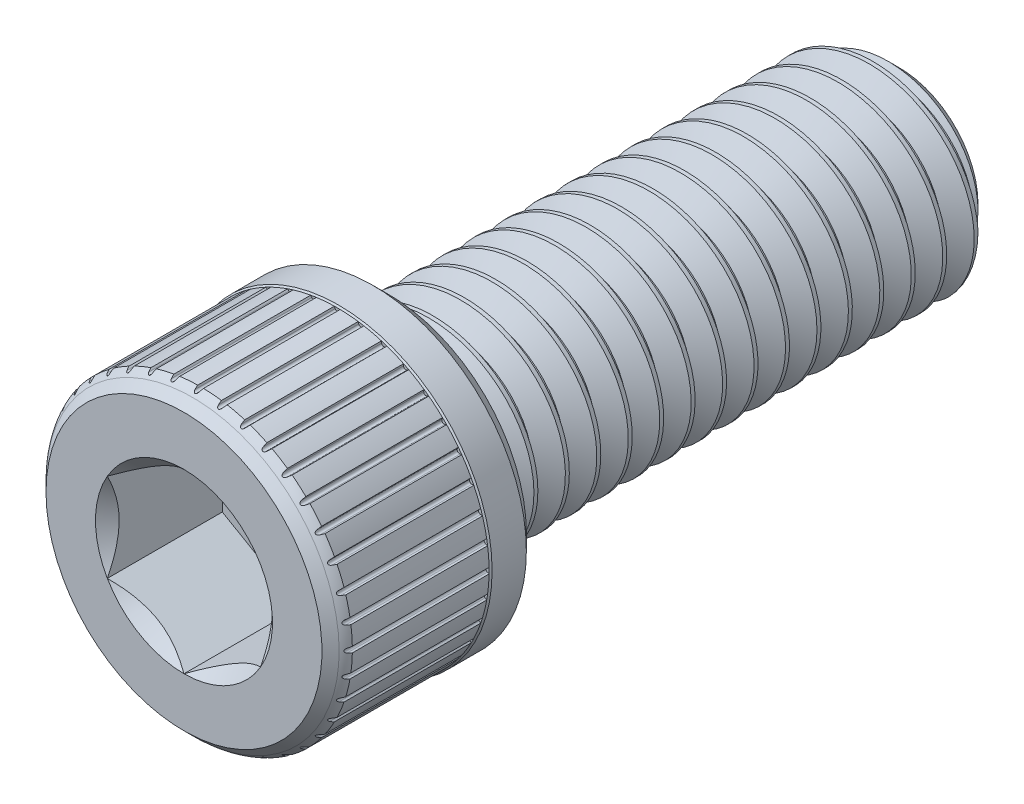
from build123d import *

# Parameters (mm, degrees)
CHAMFER1_SIZE      = 0.9525
FILLET1_R          = 1.42875
CHAMFER2_SIZE      = 1.465384615
CUT_EXTRUDE1_DEPTH = 7.14375
CUT_SWEEP1_PITCH   = 1.953846154
CUT_SWEEP1_TO      = 31.75
SKETCH10_OUTSIDE_W = 31.446
SKETCH10_OUTSIDE_H = 31.446
SKETCH10_OUTSIDE_R = 9.42975
CUT_EXTRUDE5_DEPTH = 38.432698083
CHAMFER3_SIZE      = 0.09525
CUT_EXTRUDE4_DEPTH = 38.432698032
CIRPATTERN1_COUNT  = 40


with BuildPart() as part:
    # Sketch3 → Revolve1 (revolve)
    with BuildSketch(Plane(origin=(0, 0, 0), x_dir=(0, 0, -1), z_dir=(1, 0, 0)), mode=Mode.PRIVATE) as revolve1_sk:
        Polygon((-22.225, 0), (22.225, 0), (22.225, 6.35), (-9.525, 6.35), (-9.525, 9.525), (-22.225, 9.525), align=None)
    revolve(revolve1_sk.sketch.rotate(Axis((0, 0, 22.225), (0, 0, -1)), 90), axis=Axis((0, 0, 22.225), (0, 0, -1)))

    # Chamfer1
    chamfer1_edges = [part.edges().sort_by_distance(p)[0] for p in [
        (-9.525, 0, 9.525),
        (-9.525, 0, 22.225),
    ]]
    chamfer(chamfer1_edges, length=CHAMFER1_SIZE)

    # Fillet1
    fillet1_edges = [part.edges().sort_by_distance(p)[0] for p in [
        (-9.525, 0, 21.2725),
    ]]
    fillet(fillet1_edges, radius=FILLET1_R)

    # Chamfer2
    chamfer2_edges = [part.edges().sort_by_distance(p)[0] for p in [
        (-6.35, 0, -22.225),
    ]]
    chamfer(chamfer2_edges, length=CHAMFER2_SIZE)

    # Sketch4 → Cut-Extrude1 (cut)
    with BuildSketch(Plane.XY.offset(22.225)):
        Polygon((-4.7625, -2.749630657), (0, -5.499261314), (4.7625, -2.749630657), (4.7625, 2.749630657), (0, 5.499261314), (-4.7625, 2.749630657), align=None)
    extrude(amount=-CUT_EXTRUDE1_DEPTH, mode=Mode.SUBTRACT)

    # Cut-Extrude2 cone 1 section (through the dimple's axis) → Cut-Extrude2 (revolve, cut)
    with BuildSketch(Plane(origin=(0, 0, 22.225), x_dir=(0, -1, 0), z_dir=(1, 0, 0))):
        Polygon((0, 0), (5.499261314, 0), (0, 5.499261314), align=None)
    revolve(axis=Axis((0, 0, 22.225), (0, 0, -1)), mode=Mode.SUBTRACT)


with BuildPart() as body_2:
    # Split1: read off the stored shape, not the designer's step
    # Split1: the piece on the far side of the plane
    add(part.part)
    split(bisect_by=Plane.XY.offset(9.525), keep=Keep.BOTTOM)

    # Cut-Sweep1: arcs per turn and ends read off the stored shape
    # Cut-Sweep1: the profile of Sketch7 profile screwed along a right-hand helix through 17.25 turns, 10 arcs to a turn; built about Z, then put on its axis
    cut_sweep1_z = Axis((0, 0, 0), (0, 0, 1))
    cut_sweep1_corners = [(6.3503, 0, 0.000173205), (6.3503, 0, -1.70978859), (5.080939697, 0, -0.976923077), (5.080939697, 0, -0.732692308)]
    with BuildLine(mode=Mode.PRIVATE) as cut_sweep1_profile:
        Line(cut_sweep1_corners[0], cut_sweep1_corners[1])
        Line(cut_sweep1_corners[1], cut_sweep1_corners[2])
        Line(cut_sweep1_corners[2], cut_sweep1_corners[3])
        Line(cut_sweep1_corners[3], cut_sweep1_corners[0])
    cut_sweep1_cap = Face(cut_sweep1_profile.wire())
    cut_sweep1_turn_angles = [0, 18, 36, 54, 72, 90, 108, 126, 144, 162, 180, 198, 216, 234, 252, 270, 288, 306, 324, 342, 360]
    cut_sweep1_turn_weights = [1, 0.9510565162951535, 1, 0.9510565162951535, 1, 0.9510565162951535, 1, 0.9510565162951535, 1, 0.9510565162951535, 1, 0.9510565162951535, 1, 0.9510565162951535, 1, 0.9510565162951535, 1, 0.9510565162951535, 1, 0.9510565162951535, 1]
    cut_sweep1_turn_rails = [Edge.make_bspline([Vector(p[0], p[1], 0).rotate(cut_sweep1_z, cut_sweep1_turn_angles[k]) / cut_sweep1_turn_weights[k] + Vector(0, 0, p[2] + CUT_SWEEP1_PITCH * cut_sweep1_turn_angles[k] / 360) for k in range(21)], [0, 0, 0, 1, 1, 2, 2, 3, 3, 4, 4, 5, 5, 6, 6, 7, 7, 8, 8, 9, 9, 10, 10, 10], 2, cut_sweep1_turn_weights) for p in cut_sweep1_corners]
    cut_sweep1_turn_sides = [Face.make_surface_from_curves(cut_sweep1_turn_rails[p[0]], cut_sweep1_turn_rails[p[1]]) for p in [(0, 1), (1, 2), (2, 3), (3, 0)]]
    cut_sweep1_last_angles = [6120, 6138, 6156, 6174, 6192, 6201, 6210]
    cut_sweep1_last_weights = [1, 0.9510565162951535, 1, 0.9510565162951535, 1, 0.9876883405951812, 1]
    cut_sweep1_last_rails = [Edge.make_bspline([Vector(p[0], p[1], 0).rotate(cut_sweep1_z, cut_sweep1_last_angles[k]) / cut_sweep1_last_weights[k] + Vector(0, 0, p[2] + CUT_SWEEP1_PITCH * cut_sweep1_last_angles[k] / 360) for k in range(7)], [0, 0, 0, 1, 1, 2, 2, 3, 3, 3], 2, cut_sweep1_last_weights) for p in cut_sweep1_corners]
    cut_sweep1_last_sides = [Face.make_surface_from_curves(cut_sweep1_last_rails[p[0]], cut_sweep1_last_rails[p[1]]) for p in [(0, 1), (1, 2), (2, 3), (3, 0)]]
    cut_sweep1 = Plane(origin=(0, 0, -22.225), x_dir=(0, 1, 0), z_dir=(0, 0, 1)) * split(Solid(Shell([*[p.moved(Location((0, 0, CUT_SWEEP1_PITCH * i))) for i in range(17) for p in cut_sweep1_turn_sides], *cut_sweep1_last_sides, cut_sweep1_cap, cut_sweep1_cap.rotate(cut_sweep1_z, 6210).moved(Location((0, 0, CUT_SWEEP1_PITCH * 6210 / 360)))])), bisect_by=Plane.XY.offset(CUT_SWEEP1_TO), keep=Keep.BOTTOM, mode=Mode.PRIVATE)
    add(cut_sweep1, mode=Mode.SUBTRACT)


with BuildPart() as part_1:
    add(part.part)

    # Split1
    split(bisect_by=Plane.XY.offset(9.525), keep=Keep.TOP)


with BuildPart() as body_2_1:
    add(body_2.part)

    # Combine1: union part
    add(part_1.part)

    # Sketch10 outside → Cut-Extrude5 (cut, through all)
    with BuildSketch(Plane.XY.offset(12.7)):
        Rectangle(SKETCH10_OUTSIDE_W, SKETCH10_OUTSIDE_H)
        with Locations(Location((0, 0, 0), (0, 0, 180))):
            Circle(SKETCH10_OUTSIDE_R, mode=Mode.SUBTRACT)
    extrude(amount=CUT_EXTRUDE5_DEPTH, mode=Mode.SUBTRACT)

    # Chamfer3
    chamfer3_edges = [body_2_1.edges().sort_by_distance(p)[0] for p in [
        (-9.525, 0, 12.7),
    ]]
    chamfer(chamfer3_edges, length=CHAMFER3_SIZE - 0.0001)  # a hair under: the kernel refuses the full size

    # Sketch8 → Cut-Extrude4 (cut, through all)
    with BuildSketch(Plane.XY.offset(12.7)):
        with BuildLine():
            Line((-0.129488725, 9.321743416), (-0.224268827, 9.525))
            Line((-0.224268827, 9.525), (0.224268827, 9.525))
            Line((0.224268827, 9.525), (0.129488725, 9.321743416))
            ThreePointArc((0.129488725, 9.321743416), (0, 9.23925), (-0.129488725, 9.321743416))
        make_face()
    cut_extrude4 = extrude(amount=CUT_EXTRUDE4_DEPTH, mode=Mode.SUBTRACT)

    # CirPattern1: Cut-Extrude4 ×40 about axis
    cirpattern1_axis = Axis((0, 0, 0), (0, 0, 1))
    for i in range(1, CIRPATTERN1_COUNT):
        add(cut_extrude4.rotate(cirpattern1_axis, i * 360 / CIRPATTERN1_COUNT), mode=Mode.SUBTRACT)


solid = body_2_1.part
